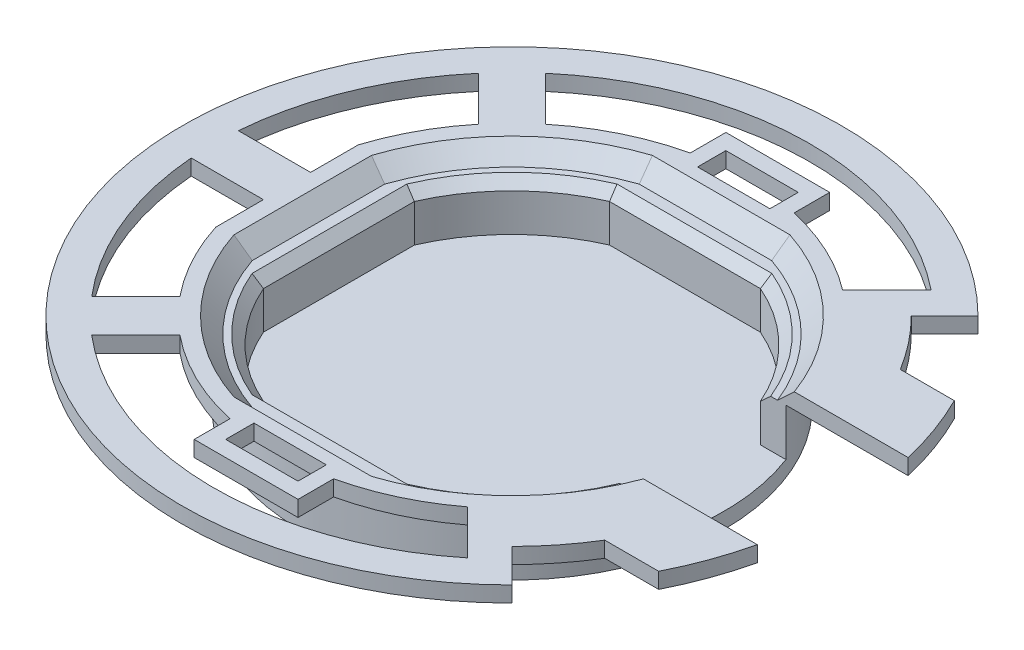
from build123d import *

# Parameters (mm, degrees)
SKETCH2_W               = 4.6
SKETCH2_H               = 1.8
WATCH_POSITIONER_DEPTH  = 1
WATCH_HOLDER_V2_DEPTH   = 4
CHAMFER1_SIZE           = 0.6
CUT_EXTRUDE1_DEPTH      = 30.733062405
CUT_EXTRUDE1_DEPTH_BACK = 30.733062405
CHAMFER2_SIZE           = 1


with BuildPart() as part:
    # Front → Base (revolve)
    with BuildSketch(Plane.XY, mode=Mode.PRIVATE) as base_sk:
        Polygon((0, 2.5), (-20.95, 2.5), (-20.95, 1.5), (-13.5, 1.5), (-13.5, -2.5), (0, -2.5), align=None)
    revolve(base_sk.sketch.rotate(Axis((0, 0, 0), (0, 1, 0)), 270), axis=Axis((0, 0, 0), (0, 1, 0)))

    # Sketch2 → Watch Positioner (cut)
    with BuildSketch(Plane(origin=(0, 2.5, 0), x_dir=(1, 0, 0), z_dir=(0, 1, 0))):
        with BuildLine():
            Line((12.3, -4.208325083), (12.3, 4.208325083))
            ThreePointArc((12.3, 4.208325083), (9.192388155, 9.192388155), (4.208325083, 12.3))
            Line((4.208325083, 12.3), (-4.208325083, 12.3))
            ThreePointArc((-4.208325083, 12.3), (-9.192388155, 9.192388155), (-12.3, 4.208325083))
            Line((-12.3, 4.208325083), (-12.3, -4.208325083))
            ThreePointArc((-12.3, -4.208325083), (-9.192388155, -9.192388155), (-4.208325083, -12.3))
            Line((-4.208325083, -12.3), (4.208325083, -12.3))
            ThreePointArc((4.208325083, -12.3), (9.192388155, -9.192388155), (12.3, -4.208325083))
        make_face()
        with Locations((0, 15)):
            Rectangle(SKETCH2_W, SKETCH2_H)
        with Locations((0, -15)):
            Rectangle(SKETCH2_W, SKETCH2_H)
    extrude(amount=-WATCH_POSITIONER_DEPTH, mode=Mode.SUBTRACT)

    # Sketch4 → Watch Holder v2 (cut)
    with BuildSketch(Plane(origin=(0, 2.5, 0), x_dir=(1, 0, 0), z_dir=(0, 1, 0))):
        with BuildLine():
            Line((4.795831523, -11), (-4.795831523, -11))
            ThreePointArc((-4.795831523, -11), (-8.485281374, -8.485281374), (-11, -4.795831523))
            Line((-11, -4.795831523), (-11, 4.795831523))
            ThreePointArc((-11, 4.795831523), (-8.485281374, 8.485281374), (-4.795831523, 11))
            Line((-4.795831523, 11), (4.795831523, 11))
            ThreePointArc((4.795831523, 11), (8.485281374, 8.485281374), (11, 4.795831523))
            Line((11, 4.795831523), (21.95, 4.795831523))
            Line((21.95, 4.795831523), (21.95, -4.795831523))
            Line((21.95, -4.795831523), (11, -4.795831523))
            ThreePointArc((11, -4.795831523), (8.485281374, -8.485281374), (4.795831523, -11))
        make_face()
        with BuildLine():
            Line((15.294471223, 9.395831523), (19.837359955, 9.395831523))
            ThreePointArc((19.837359955, 9.395831523), (17.942483085, 12.643963015), (15.520993847, 15.520993847))
            Line((15.520993847, 15.520993847), (12.692566722, 12.692566722))
            ThreePointArc((12.692566722, 12.692566722), (14.090269301, 11.120558036), (15.294471223, 9.395831523))
        make_face()
        with BuildLine():
            Line((15.520993847, -15.520993847), (12.692566722, -12.692566722))
            ThreePointArc((12.692566722, -12.692566722), (14.090269301, -11.120558036), (15.294471223, -9.395831523))
            Line((15.294471223, -9.395831523), (19.837359955, -9.395831523))
            ThreePointArc((19.837359955, -9.395831523), (17.942483085, -12.643963015), (15.520993847, -15.520993847))
        make_face()
    extrude(amount=-WATCH_HOLDER_V2_DEPTH, mode=Mode.SUBTRACT)

    # Chamfer1
    chamfer1_edges = [part.edges().sort_by_distance(p)[0] for p in [
        (0, 1.5, 11),
        (8.485281374, 1.5, 8.485281374),
        (-8.485281374, 1.5, 8.485281374),
        (-11, 1.5, 0),
        (-8.485281374, 1.5, -8.485281374),
        (0, 1.5, -11),
        (8.485281374, 1.5, -8.485281374),
    ]]
    chamfer(chamfer1_edges, length=CHAMFER1_SIZE)

    # Sketch5 → Cut-Extrude1 (cut, two sides: drawn at the far end of the back side and taken through both)
    with BuildSketch(Plane(origin=(0, 0, 0), x_dir=(1, 0, 0), z_dir=(0, 1, 0)).offset(-CUT_EXTRUDE1_DEPTH_BACK)):
        with BuildLine():
            Line((-12.296968735, 14.418289078), (-9.492775288, 11.614095631))
            ThreePointArc((-9.492775288, 11.614095631), (-6.572021243, 13.483639597), (-3.3, 14.632498078))
            Line((-3.3, 14.632498078), (-3.3, 16.9))
            Line((-3.3, 16.9), (3.3, 16.9))
            Line((3.3, 16.9), (3.3, 14.632498078))
            ThreePointArc((3.3, 14.632498078), (6.344822846, 13.592027923), (9.097684458, 11.926111583))
            Line((9.097684458, 11.926111583), (11.910622272, 14.739049396))
            ThreePointArc((11.910622272, 14.739049396), (-0.251073083, 18.948336663), (-12.296968735, 14.418289078))
        make_face()
        with BuildLine():
            Line((-14.418289078, 12.296968735), (-11.614095631, 9.492775288))
            ThreePointArc((-11.614095631, 9.492775288), (-13.192625168, 7.138251969), (-14.3, 4.52879675))
            Line((-14.3, 4.52879675), (-14.3, 1.5))
            Line((-14.3, 1.5), (-18.890539961, 1.5))
            ThreePointArc((-18.890539961, 1.5), (-17.507517141, 7.251851043), (-14.418289078, 12.296968735))
        make_face()
        with BuildLine():
            Line((-18.890539961, -1.5), (-14.3, -1.5))
            Line((-14.3, -1.5), (-14.3, -4.52879675))
            ThreePointArc((-14.3, -4.52879675), (-13.192625168, -7.138251969), (-11.614095631, -9.492775288))
            Line((-11.614095631, -9.492775288), (-14.418289078, -12.296968735))
            ThreePointArc((-14.418289078, -12.296968735), (-17.507517141, -7.251851043), (-18.890539961, -1.5))
        make_face()
        with BuildLine():
            Line((9.097684458, -11.926111583), (11.910622272, -14.739049396))
            ThreePointArc((11.910622272, -14.739049396), (-0.251073083, -18.948336663), (-12.296968735, -14.418289078))
            Line((-12.296968735, -14.418289078), (-9.492775288, -11.614095631))
            ThreePointArc((-9.492775288, -11.614095631), (-6.572021243, -13.483639597), (-3.3, -14.632498078))
            Line((-3.3, -14.632498078), (-3.3, -16.9))
            Line((-3.3, -16.9), (3.3, -16.9))
            Line((3.3, -16.9), (3.3, -14.632498078))
            ThreePointArc((3.3, -14.632498078), (6.344822846, -13.592027923), (9.097684458, -11.926111583))
        make_face()
    extrude(amount=CUT_EXTRUDE1_DEPTH + CUT_EXTRUDE1_DEPTH_BACK, mode=Mode.SUBTRACT)

    # Chamfer2
    chamfer2_edges = [part.edges().sort_by_distance(p)[0] for p in [
        (8.968295761, 2.5, 9.411146112),
    ]]
    chamfer(chamfer2_edges, length=CHAMFER2_SIZE - 0.0001)  # a hair under: the kernel refuses the full size
    chamfer2_2_edges = [part.edges().sort_by_distance(p)[0] for p in [
        (8.968295761, 2.5, -9.411146112),
    ]]
    chamfer(chamfer2_2_edges, length=CHAMFER2_SIZE - 0.0001)  # a hair under: the kernel refuses the full size
    chamfer2_3_edges = [part.edges().sort_by_distance(p)[0] for p in [
        (-9.192388155, 2.5, 9.192388155),
    ]]
    chamfer(chamfer2_3_edges, length=CHAMFER2_SIZE - 0.0001)  # a hair under: the kernel refuses the full size
    chamfer2_4_edges = [part.edges().sort_by_distance(p)[0] for p in [
        (-9.192388155, 2.5, -9.192388155),
    ]]
    chamfer(chamfer2_4_edges, length=CHAMFER2_SIZE - 0.0001)  # a hair under: the kernel refuses the full size
    chamfer2_5_edges = [part.edges().sort_by_distance(p)[0] for p in [
        (0, 2.5, 12.3),
    ]]
    chamfer(chamfer2_5_edges, length=CHAMFER2_SIZE - 0.0001)  # a hair under: the kernel refuses the full size
    chamfer2_6_edges = [part.edges().sort_by_distance(p)[0] for p in [
        (0, 2.5, -12.3),
    ]]
    chamfer(chamfer2_6_edges, length=CHAMFER2_SIZE - 0.0001)  # a hair under: the kernel refuses the full size
    chamfer2_7_edges = [part.edges().sort_by_distance(p)[0] for p in [
        (-12.3, 2.5, 0),
    ]]
    chamfer(chamfer2_7_edges, length=CHAMFER2_SIZE - 0.0001)  # a hair under: the kernel refuses the full size


solid = part.part
